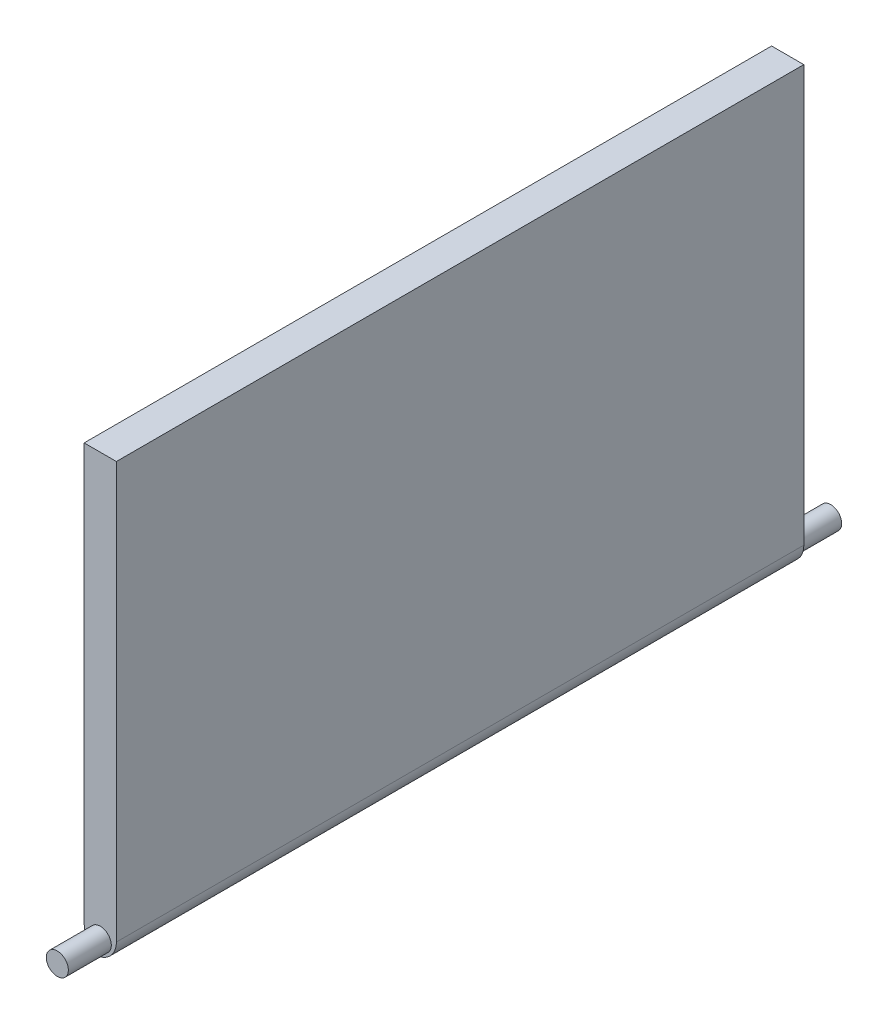
from build123d import *

# Parameters (mm, degrees)
SKETCH1_W           = 101.6
SKETCH1_H           = 64.682803082
BOSS_EXTRUDE1_DEPTH = 4.7625
SKETCH2_R           = 1.631191497
BOSS_EXTRUDE2_DEPTH = 6.35
FILLET2_R           = 3.175


with BuildPart() as part:
    # Sketch1 → Boss-Extrude1 (new body)
    with BuildSketch(Plane(origin=(0, 0, 0), x_dir=(0, 0, -1), z_dir=(1, 0, 0))):
        with Locations((0, 26.994954374)):
            Rectangle(SKETCH1_W, SKETCH1_H)
    extrude(amount=-BOSS_EXTRUDE1_DEPTH)

    # Sketch2 → Boss-Extrude2 (add)
    with BuildSketch(Plane.XY.offset(50.8)):
        with Locations((-2.38125, -2.965197167)):
            Circle(SKETCH2_R)
    boss_extrude2 = extrude(amount=BOSS_EXTRUDE2_DEPTH)

    # Mirror1: Boss-Extrude2 across plane
    add(boss_extrude2.mirror(Plane.XY))

    # Fillet2
    # the kernel refuses this fillet: 3.175 mm, written as the material it takes off along each edge
    with BuildSketch(Plane(origin=(0, -5.346447167, 58.7375), x_dir=(0, 1, 0), z_dir=(0, 0, -1))) as fillet2_piece_1:
        with BuildLine():
            CenterArc((FILLET2_R, -FILLET2_R), FILLET2_R, 90, 90)
            Line((0, -FILLET2_R), (0, 0))
            Line((0, 0), (FILLET2_R, 0))
        make_face()
    extrude(amount=117.475, mode=Mode.SUBTRACT)
    with BuildSketch(Plane(origin=(-4.7625, -5.346447167, 58.7375), x_dir=(0, 1, 0), z_dir=(0, 0, -1))) as fillet2_piece_2:
        with BuildLine():
            CenterArc((FILLET2_R, FILLET2_R), FILLET2_R, 180, 90)
            Line((0, FILLET2_R), (0, 0))
            Line((0, 0), (FILLET2_R, 0))
        make_face()
    extrude(amount=117.475, mode=Mode.SUBTRACT)


solid = part.part
